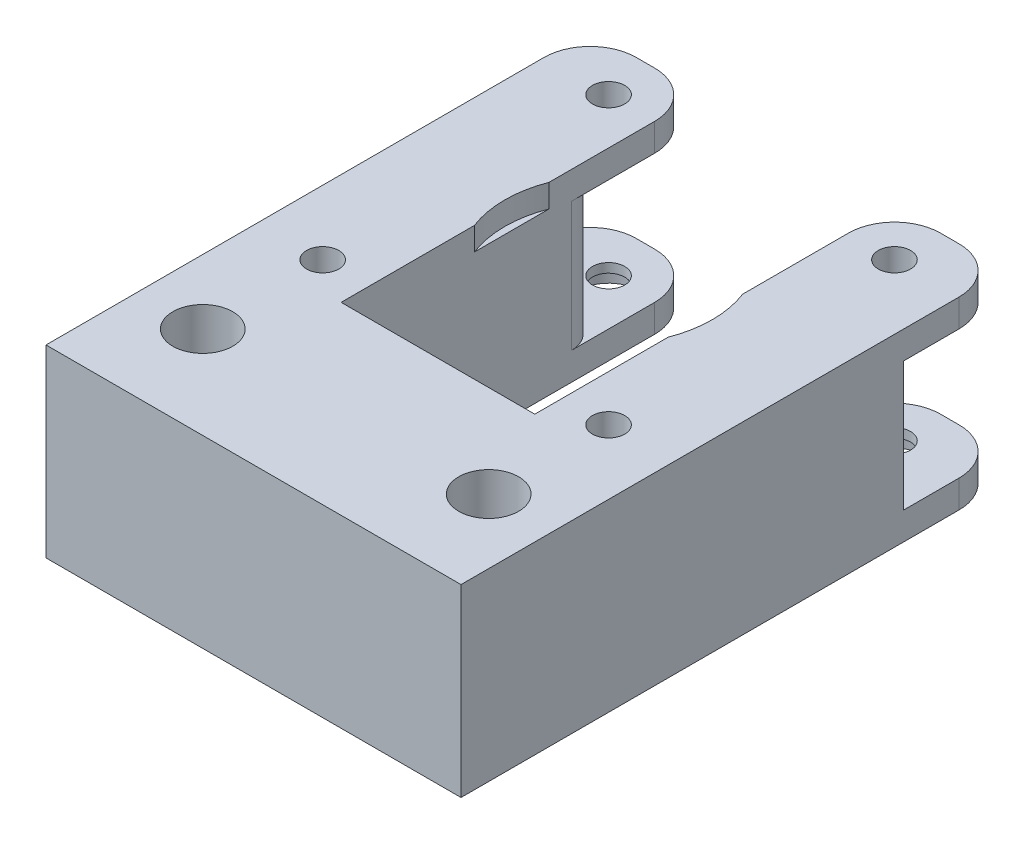
from build123d import *

# Parameters (mm, degrees)
SKETCH1_W                                           = 45
SKETCH1_H                                           = 20
BOSS_EXTRUDE1_DEPTH                                 = 20
SKETCH2_W                                           = 12
SKETCH2_H                                           = 20
BOSS_EXTRUDE2_DEPTH                                 = 40
SKETCH3_R                                           = 1.75
CUT_EXTRUDE1_DEPTH                                  = 59.36308765
SKETCH4_R                                           = 1.75
CUT_EXTRUDE2_DEPTH                                  = 25
CBORE_FOR_M3_HEX_SOCKET_HEAD_CAP_SCREW1_D           = 3.5
CBORE_FOR_M3_HEX_SOCKET_HEAD_CAP_SCREW1_CBORE_D     = 6.5
CBORE_FOR_M3_HEX_SOCKET_HEAD_CAP_SCREW1_CBORE_DEPTH = 11.4
CBORE_FOR_M3_HEX_SOCKET_HEAD_CAP_SCREW2_D           = 3.5
CBORE_FOR_M3_HEX_SOCKET_HEAD_CAP_SCREW2_CBORE_D     = 6.5
CBORE_FOR_M3_HEX_SOCKET_HEAD_CAP_SCREW2_CBORE_DEPTH = 2
CBORE_FOR_M3_PAN_HEAD_SCREW1_D                      = 3.5
CBORE_FOR_M3_PAN_HEAD_SCREW1_CBORE_D                = 6.5
CBORE_FOR_M3_PAN_HEAD_SCREW1_CBORE_DEPTH            = 12.4
CUT_EXTRUDE3_DEPTH                                  = 71.178344238
CUT_EXTRUDE3_DEPTH_BACK                             = 71.178344238
SKETCH9_W                                           = 12
SKETCH9_H                                           = 14
SKETCH10_W                                          = 12
SKETCH10_H                                          = 3
CUT_EXTRUDE5_DEPTH                                  = 1
FILLET2_R                                           = 5
FILLET5_R                                           = 3
SKETCH13_R                                          = 11.25
CUT_EXTRUDE6_DEPTH                                  = 2.5


with BuildPart() as part:
    # Sketch1 → Boss-Extrude1 (new body)
    with BuildSketch(Plane(origin=(0, 0, 0), x_dir=(1, 0, 0), z_dir=(0, 1, 0))):
        Rectangle(SKETCH1_W, SKETCH1_H)
    extrude(amount=BOSS_EXTRUDE1_DEPTH)

    # Sketch2 → Boss-Extrude2 (add)
    with BuildSketch(Plane(origin=(0, 0, -10), x_dir=(-1, 0, 0), z_dir=(0, 0, -1))):
        with Locations((-16.5, 10)):
            Rectangle(SKETCH2_W, SKETCH2_H)
        with Locations((16.5, 10)):
            Rectangle(SKETCH2_W, SKETCH2_H)
    extrude(amount=BOSS_EXTRUDE2_DEPTH)

    # Sketch3 → Cut-Extrude1 (cut, through all)
    with BuildSketch(Plane(origin=(0, 20, 0), x_dir=(1, 0, 0), z_dir=(0, 1, 0))):
        with Locations((15.5, 44)):
            Circle(SKETCH3_R)
        with Locations((15.5, 13)):
            Circle(SKETCH3_R)
        with Locations((-15.5, 13)):
            Circle(SKETCH3_R)
        with Locations((-15.5, 44)):
            Circle(SKETCH3_R)
    extrude(amount=-CUT_EXTRUDE1_DEPTH, mode=Mode.SUBTRACT)

    # Sketch4 → Cut-Extrude2 (cut)
    with BuildSketch(Plane(origin=(0, 20, 0), x_dir=(1, 0, 0), z_dir=(0, 1, 0))):
        with Locations((-15.5, 0)):
            Circle(SKETCH4_R)
        with Locations((15.5, 0)):
            Circle(SKETCH4_R)
    extrude(amount=-CUT_EXTRUDE2_DEPTH, mode=Mode.SUBTRACT)

    # CBORE for M3 Hex Socket Head Cap Screw1 (through all)
    with Locations(Plane(origin=(0, 20, 0), x_dir=(1, 0, 0), z_dir=(0, 1, 0))):
        with Locations((15.5, 0), (-15.5, 0)):
            CounterBoreHole(CBORE_FOR_M3_HEX_SOCKET_HEAD_CAP_SCREW1_D / 2, CBORE_FOR_M3_HEX_SOCKET_HEAD_CAP_SCREW1_CBORE_D / 2, CBORE_FOR_M3_HEX_SOCKET_HEAD_CAP_SCREW1_CBORE_DEPTH)

    # CBORE for M3 Hex Socket Head Cap Screw2 (through all)
    with Locations(Plane(origin=(0, 0, 0), x_dir=(-1, 0, 0), z_dir=(0, -1, 0))):
        with Locations((15.5, 44), (15.5, 13), (-15.5, 13), (-15.5, 44)):
            CounterBoreHole(CBORE_FOR_M3_HEX_SOCKET_HEAD_CAP_SCREW2_D / 2, CBORE_FOR_M3_HEX_SOCKET_HEAD_CAP_SCREW2_CBORE_D / 2, CBORE_FOR_M3_HEX_SOCKET_HEAD_CAP_SCREW2_CBORE_DEPTH)

    # CBORE for M3 Pan Head Screw1 (through all)
    with Locations(Plane(origin=(0, 0, 0), x_dir=(-1, 0, 0), z_dir=(0, -1, 0))):
        with Locations((-15.5, 13), (15.5, 13)):
            CounterBoreHole(CBORE_FOR_M3_PAN_HEAD_SCREW1_D / 2, CBORE_FOR_M3_PAN_HEAD_SCREW1_CBORE_D / 2, CBORE_FOR_M3_PAN_HEAD_SCREW1_CBORE_DEPTH)

    # Sketch9 → Cut-Extrude3 (cut, two sides: drawn at the far end of the back side and taken through both)
    with BuildSketch(Plane(origin=(22.5, 0, 0), x_dir=(0, 0, -1), z_dir=(1, 0, 0)).offset(-CUT_EXTRUDE3_DEPTH_BACK)):
        with Locations((44, 10)):
            Rectangle(SKETCH9_W, SKETCH9_H)
    extrude(amount=CUT_EXTRUDE3_DEPTH + CUT_EXTRUDE3_DEPTH_BACK, mode=Mode.SUBTRACT)

    # Sketch10 → Cut-Extrude5 (cut)
    with BuildSketch(Plane(origin=(0, 0, -50), x_dir=(-1, 0, 0), z_dir=(0, 0, -1))):
        with Locations((-16.5, 1.5)):
            Rectangle(SKETCH10_W, SKETCH10_H)
        with Locations((16.5, 1.5)):
            Rectangle(SKETCH10_W, SKETCH10_H)
        with Locations((-16.5, 18.5)):
            Rectangle(SKETCH10_W, SKETCH10_H)
        with Locations((16.5, 18.5)):
            Rectangle(SKETCH10_W, SKETCH10_H)
    extrude(amount=-CUT_EXTRUDE5_DEPTH, mode=Mode.SUBTRACT)

    # Fillet2
    fillet2_edges = [part.edges().sort_by_distance(p)[0] for p in [
        (-10.5, 1.5, -49),
        (10.5, 1.5, -49),
        (-10.5, 18.5, -49),
        (10.5, 18.5, -49),
        (-22.5, 18.5, -49),
        (-22.5, 1.5, -49),
        (22.5, 1.5, -49),
        (22.5, 18.5, -49),
    ]]
    fillet(fillet2_edges, radius=FILLET2_R)

    # Fillet5
    fillet5_edges = [part.edges().sort_by_distance(p)[0] for p in [
        (-10.5, 10, -38),
        (10.5, 10, -38),
    ]]
    fillet(fillet5_edges, radius=FILLET5_R)

    # Sketch13 → Cut-Extrude6 (cut)
    with BuildSketch(Plane(origin=(0, 20, 0), x_dir=(1, 0, 0), z_dir=(0, 1, 0))):
        with Locations((0, 28.5)):
            Circle(SKETCH13_R)
    extrude(amount=-CUT_EXTRUDE6_DEPTH, mode=Mode.SUBTRACT)


solid = part.part
